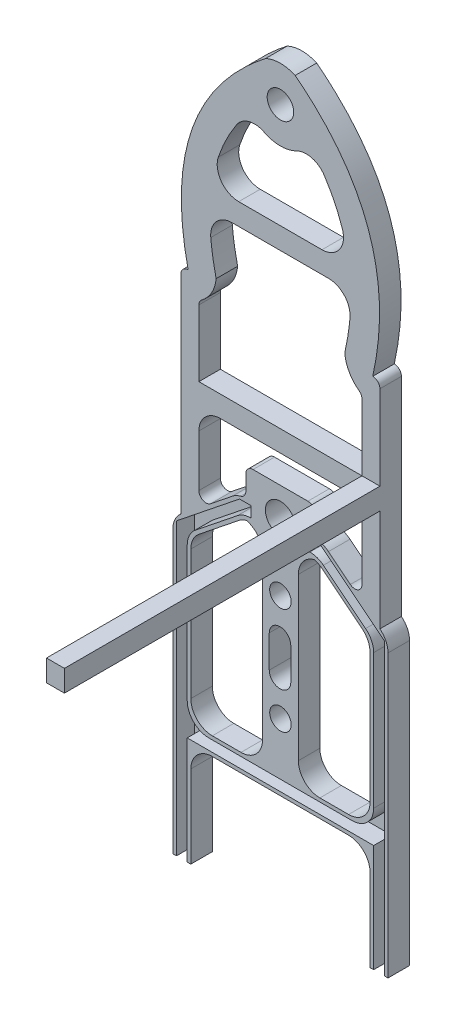
from build123d import *

# Parameters (mm, degrees)
SKETCH1_R            = 15
BOSS_EXTRUDE2_DEPTH  = 30
CUT_EXTRUDE1_DEPTH   = 25
SKETCH5_W            = 50
SKETCH5_H            = 200
SKETCH5_H_2          = 175
CUT_EXTRUDE2_DEPTH   = 30
FILLET12_R           = 30
SKETCH6_W            = 25
SKETCH6_H            = 285
BOSS_EXTRUDE3_DEPTH  = 30
SKETCH7_R            = 15
CUT_EXTRUDE3_DEPTH   = 30
FILLET13_R           = 30
FILLET14_R           = 30
SKETCH8_W            = 30
SKETCH8_H            = 75
CUT_EXTRUDE4_DEPTH   = 30
FILLET15_R           = 15
FILLET16_R           = 15
SKETCH9_W            = 338.809244033
SKETCH9_H            = 97.141111926
CUT_EXTRUDE5_DEPTH   = 180
FILLET17_R           = 30
SKETCH10_W           = 327.747288066
SKETCH10_H           = 89.1185355
CUT_EXTRUDE6_DEPTH   = 50
SKETCH11_W           = 96.492189406
SKETCH11_H           = 40
BOSS_EXTRUDE5_DEPTH  = 30
SKETCH12_R           = 15
CUT_EXTRUDE7_DEPTH   = 30
FILLET18_R           = 10
BOSS_EXTRUDE6_DEPTH  = 30
FILLET19_R           = 10
SKETCH18_W           = 81.820550709
SKETCH18_H           = 15
BOSS_EXTRUDE11_DEPTH = 30
SKETCH19_R           = 21
CUT_EXTRUDE9_DEPTH   = 500
SKETCH20_R           = 18.5
BOSS_EXTRUDE12_DEPTH = 30
SKETCH21_W           = 25
SKETCH21_H           = 30
BOSS_EXTRUDE13_DEPTH = 440
SKETCH22_W           = 179.403270764
SKETCH22_H           = 25
CUT_EXTRUDE10_DEPTH  = 440
SKETCH23_W           = 219.281894342
SKETCH23_H           = 30
BOSS_EXTRUDE14_DEPTH = 30
FILLET25_R           = 50
BOSS_EXTRUDE16_REACH = 1016.707
SKETCH26_W           = 30
SKETCH26_H           = 29.541809427
FILLET26_R           = 30
FILLET28_R           = 30


# Some blends are built 0.0001 mm under size
with BuildPart() as part:
    # Sketch1 → Boss-Extrude2 (new body)
    with BuildSketch(Plane.XY):
        Polygon((25, -200), (-25, -200), (-25, -25), (-125, -25), (-125, -400), (-150, -400), (-150, 0), (-150, 237.015621187), (-58.769526484, 310), (58.769526484, 310), (150, 237.015621187), (150, 0), (150, -400), (125, -400), (125, -25), (25, -25), align=None)
        with Locations((0, 162.622371244)):
            Circle(SKETCH1_R, mode=Mode.SUBTRACT)
        with Locations((0, -162.622371244)):
            Circle(SKETCH1_R, mode=Mode.SUBTRACT)
        Polygon((25, 200), (-25, 200), (-25, 0), (-125, 0), (-125, 225), (-50, 285), (50, 285), (125, 225), (125, 0), (25, 0), align=None, mode=Mode.SUBTRACT)
    extrude(amount=BOSS_EXTRUDE2_DEPTH)

    # Sketch2 → Cut-Extrude1 (cut)
    with BuildSketch(Plane.XY.offset(30)):
        Polygon((145, -400), (145, 234.61249695), (57.015621187, 305), (-57.015621187, 305), (-145, 234.61249695), (-145, -400), (-130, -400), (-130, -25), (-130, -20), (-125, -20), (-25, -20), (25, -20), (125, -20), (130, -20), (130, -25), (130, -400), align=None)
        Polygon((130, 0), (130, 227.403124237), (51.753905297, 290), (-51.753905297, 290), (-130, 227.403124237), (-130, 0), (-130, -5), (-125, -5), (-25, -5), (25, -5), (125, -5), (130, -5), align=None, mode=Mode.SUBTRACT)
    extrude(amount=-CUT_EXTRUDE1_DEPTH, mode=Mode.SUBTRACT)

    # Sketch5 → Cut-Extrude2 (cut)
    with BuildSketch(Plane.XY.offset(30)):
        with Locations((0, 100)):
            Rectangle(SKETCH5_W, SKETCH5_H)
        with Locations((0, -112.5)):
            Rectangle(SKETCH5_W, SKETCH5_H_2)
    extrude(amount=-CUT_EXTRUDE2_DEPTH, mode=Mode.SUBTRACT)

    # Fillet12
    fillet12_edges = [part.edges().sort_by_distance(p)[0] for p in [
        (-51.753905297, 290, 17.5),
        (51.753905297, 290, 17.5),
    ]]
    fillet(fillet12_edges, radius=FILLET12_R)

    # Sketch6 → Boss-Extrude3 (add)
    with BuildSketch(Plane(origin=(0, 0, 0), x_dir=(-1, 0, 0), z_dir=(0, 0, -1))):
        with Locations((-12.5, 142.5)):
            Rectangle(SKETCH6_W, SKETCH6_H)
        with Locations((12.5, 142.5)):
            Rectangle(SKETCH6_W, SKETCH6_H)
    extrude(amount=-BOSS_EXTRUDE3_DEPTH)

    # Sketch7 → Cut-Extrude3 (cut)
    with BuildSketch(Plane(origin=(0, 0, 0), x_dir=(-1, 0, 0), z_dir=(0, 0, -1))):
        with Locations((0, 216.75)):
            Circle(SKETCH7_R)
        with Locations(Location((0, 68.25, 0), (0, 0, 180))):
            Circle(SKETCH7_R)
    extrude(amount=-CUT_EXTRUDE3_DEPTH, mode=Mode.SUBTRACT)

    # Fillet13
    # the kernel refuses this fillet: 30 mm, written as the material it adds along each edge
    with BuildSketch(Plane(origin=(-25, 0, 0), x_dir=(-1, 0, 0), z_dir=(0, 0, 1)), Plane(origin=(-25, 285, 0), x_dir=(0, -1, 0), z_dir=(0, 0, 1)), Plane(origin=(125, 0, 0), x_dir=(-1, 0, 0), z_dir=(0, 0, 1))) as fillet13_piece_1:
        with BuildLine():
            CenterArc((FILLET13_R, -FILLET13_R), FILLET13_R, 90, 90)
            Line((0, -FILLET13_R), (0, 0))
            Line((0, 0), (FILLET13_R, 0))
        make_face()
    extrude(amount=30)
    with BuildSketch(Plane(origin=(25, 0, 0), x_dir=(1, 0, 0), z_dir=(0, 0, 1)), Plane(origin=(25, 285, 0), x_dir=(0, -1, 0), z_dir=(0, 0, 1)), Plane(origin=(-125, 0, 0), x_dir=(1, 0, 0), z_dir=(0, 0, 1))) as fillet13_piece_2:
        with BuildLine():
            CenterArc((FILLET13_R, FILLET13_R), FILLET13_R, 180, 90)
            Line((0, FILLET13_R), (0, 0))
            Line((0, 0), (FILLET13_R, 0))
        make_face()
    extrude(amount=30)
    with BuildSketch(Plane(origin=(125, 225, 0), x_dir=(0, -1, 0), z_dir=(0, 0, 1))) as fillet13_piece_3:
        with BuildLine():
            CenterArc((FILLET13_R * 0.480624847487, -FILLET13_R), FILLET13_R, 90, 51.340191746)
            Line((-FILLET13_R * 0.300243961956, -FILLET13_R * 0.375304952446), (0, 0))
            Line((0, 0), (FILLET13_R * 0.480624847487, 0))
        make_face()
    extrude(amount=30)
    with BuildSketch(Plane(origin=(50, 285, 0), x_dir=(-1, 0, 0), z_dir=(0, 0, 1)), Plane(origin=(-50, 285, 0), x_dir=(-0.7808688094430287, -0.6246950475544262, 0), z_dir=(0, 0, 1))) as fillet13_piece_4:
        with BuildLine():
            CenterArc((FILLET13_R * 0.350781059358, FILLET13_R), FILLET13_R, 231.340191746, 38.659808254)
            Line((-FILLET13_R * 0.273913988196, FILLET13_R * 0.219131190557), (0, 0))
            Line((0, 0), (FILLET13_R * 0.350781059358, 0))
        make_face()
    extrude(amount=30)
    with BuildSketch(Plane(origin=(-125, 225, 0), x_dir=(0, -1, 0), z_dir=(0, 0, 1))) as fillet13_piece_5:
        with BuildLine():
            CenterArc((FILLET13_R * 0.480624847487, FILLET13_R), FILLET13_R, 218.659808254, 51.340191746)
            Line((-FILLET13_R * 0.300243961956, FILLET13_R * 0.375304952446), (0, 0))
            Line((0, 0), (FILLET13_R * 0.480624847487, 0))
        make_face()
    extrude(amount=30)
    # the kernel refuses this fillet: 30 mm, written as the material it takes off along each edge
    with BuildSketch(Plane(origin=(-150, 237.015621187, -36.046863561), x_dir=(0, -1, 0), z_dir=(0, 0, 1))) as fillet13_2_piece_1:
        with BuildLine():
            CenterArc((FILLET13_R * 0.480624847487, FILLET13_R), FILLET13_R, 218.659808254, 51.340191746)
            Line((-FILLET13_R * 0.300243961956, FILLET13_R * 0.375304952446), (0, 0))
            Line((0, 0), (FILLET13_R * 0.480624847487, 0))
        make_face()
    extrude(amount=102.093727123, mode=Mode.SUBTRACT)
    with BuildSketch(Plane(origin=(-58.769526484, 310, -26.308579452), x_dir=(1, 0, 0), z_dir=(0, 0, 1)), Plane(origin=(58.769526484, 310, -26.308579452), x_dir=(0.7808688094430305, -0.6246950475544238, 0), z_dir=(0, 0, 1))) as fillet13_2_piece_2:
        with BuildLine():
            CenterArc((FILLET13_R * 0.350781059358, -FILLET13_R), FILLET13_R, 90, 38.659808254)
            Line((-FILLET13_R * 0.273913988196, -FILLET13_R * 0.219131190557), (0, 0))
            Line((0, 0), (FILLET13_R * 0.350781059358, 0))
        make_face()
    extrude(amount=82.617158904, mode=Mode.SUBTRACT)
    with BuildSketch(Plane(origin=(150, 237.015621187, -36.046863561), x_dir=(0, -1, 0), z_dir=(0, 0, 1))) as fillet13_2_piece_3:
        with BuildLine():
            CenterArc((FILLET13_R * 0.480624847487, -FILLET13_R), FILLET13_R, 90, 51.340191746)
            Line((-FILLET13_R * 0.300243961956, -FILLET13_R * 0.375304952446), (0, 0))
            Line((0, 0), (FILLET13_R * 0.480624847487, 0))
        make_face()
    extrude(amount=102.093727123, mode=Mode.SUBTRACT)

    # Fillet14
    fillet14_edges = [part.edges().sort_by_distance(p)[0] for p in [
        (-130, 227.403124237, 17.5),
        (130, 227.403124237, 17.5),
        (130, -5, 17.5),
        (-130, -5, 17.5),
    ]]
    fillet(fillet14_edges, radius=FILLET14_R)

    # Sketch8 → Cut-Extrude4 (cut)
    with BuildSketch(Plane.XY.offset(30)):
        with Locations((-0.603833869, 141.522485527)):
            Rectangle(SKETCH8_W, SKETCH8_H)
    extrude(amount=-CUT_EXTRUDE4_DEPTH, mode=Mode.SUBTRACT)

    # Fillet15
    fillet15_edges = [part.edges().sort_by_distance(p)[0] for p in [
        (-15.603833869, 179.022485527, 15),
        (14.396166131, 179.022485527, 15),
    ]]
    fillet(fillet15_edges, radius=FILLET15_R - 0.0001)  # a hair under: the kernel refuses the full size

    # Fillet16
    fillet16_edges = [part.edges().sort_by_distance(p)[0] for p in [
        (-15.603833869, 104.022485527, 15),
        (14.396166131, 104.022485527, 15),
    ]]
    fillet(fillet16_edges, radius=FILLET16_R - 0.0001)  # a hair under: the kernel refuses the full size

    # Sketch9 → Cut-Extrude5 (cut)
    with BuildSketch(Plane.XZ.offset(400)):
        with Locations((2.764177981, 12.038380734)):
            Rectangle(SKETCH9_W, SKETCH9_H)
    extrude(amount=-CUT_EXTRUDE5_DEPTH, mode=Mode.SUBTRACT)

    # Fillet17
    fillet17_edges = [part.edges().sort_by_distance(p)[0] for p in [
        (-125, -25, 15),
        (125, -25, 15),
    ]]
    fillet(fillet17_edges, radius=FILLET17_R)

    # Sketch10 → Cut-Extrude6 (cut)
    with BuildSketch(Plane.XZ.offset(220)):
        with Locations((2.723742007, 14.352989255)):
            Rectangle(SKETCH10_W, SKETCH10_H)
    extrude(amount=-CUT_EXTRUDE6_DEPTH, mode=Mode.SUBTRACT)

    # Sketch11 → Boss-Extrude5 (add)
    with BuildSketch(Plane(origin=(0, 0, 0), x_dir=(-1, 0, 0), z_dir=(0, 0, -1))):
        with Locations((0, 330)):
            Rectangle(SKETCH11_W, SKETCH11_H)
    extrude(amount=-BOSS_EXTRUDE5_DEPTH)

    # Sketch12 → Cut-Extrude7 (cut)
    with BuildSketch(Plane(origin=(0, 0, 0), x_dir=(-1, 0, 0), z_dir=(0, 0, -1))):
        with Locations((0, 309.75)):
            Circle(SKETCH12_R)
    extrude(amount=-CUT_EXTRUDE7_DEPTH, mode=Mode.SUBTRACT)

    # Fillet18
    fillet18_edges = [part.edges().sort_by_distance(p)[0] for p in [
        (-48.246094703, 310, 15),
        (48.246094703, 310, 15),
        (48.246094703, 350, 15),
        (-48.246094703, 350, 15),
    ]]
    fillet(fillet18_edges, radius=FILLET18_R)

    # Sketch13 → Boss-Extrude6 (add)
    with BuildSketch(Plane(origin=(0, 0, 0), x_dir=(-1, 0, 0), z_dir=(0, 0, -1))):
        Polygon((138.740851427, 246.022940046), (138.740851427, 546.022940046), (-138.740851427, 546.022940046), (-138.740851427, 246.022940046), (-113.740851427, 266.022940046), (-113.740851427, 521.022940046), (113.740851427, 521.022940046), (113.740851427, 266.022940046), align=None)
    extrude(amount=-BOSS_EXTRUDE6_DEPTH)

    # Fillet19
    fillet19_edges = [part.edges().sort_by_distance(p)[0] for p in [
        (-113.740851427, 266.022940046, 15),
        (-113.740851427, 521.022940046, 15),
        (113.740851427, 521.022940046, 15),
        (113.740851427, 266.022940046, 15),
        (138.740851427, 546.022940046, 15),
        (-138.740851427, 546.022940046, 15),
    ]]
    fillet(fillet19_edges, radius=FILLET19_R)

    # Sketch18 → Boss-Extrude11 (add, through all)
    with BuildSketch(Plane.XY.offset(30)):
        with Locations((-0.320198162, 297.5)):
            Rectangle(SKETCH18_W, SKETCH18_H)
    extrude(amount=-BOSS_EXTRUDE11_DEPTH)

    # Sketch19 → Cut-Extrude9 (cut)
    with BuildSketch(Plane.XY.offset(30)):
        with Locations((0, 309.75)):
            Circle(SKETCH19_R)
    extrude(amount=-CUT_EXTRUDE9_DEPTH, mode=Mode.SUBTRACT)

    # Sketch20 → Boss-Extrude12 (add)
    with BuildSketch(Plane(origin=(0, 0, 0), x_dir=(-1, 0, 0), z_dir=(0, 0, -1))):
        with BuildLine():
            add(Edge.make_bspline(
                [(89.701635382, 554.737273676), (90.94148044, 560.181929688), (94.121591054, 576.229523324), (97.653790592, 602.020813506), (98.983134054, 636.143564767), (95.23140752, 672.288382312), (86.385439091, 705.942796648), (72.424108525, 737.575728698), (55.122350666, 764.46748221), (43.463482556, 778.623614239), (41.125546485, 781.312534813)],
                knots=[0, 0, 0, 0.03125, 0.09375, 0.1875, 0.3125, 0.4375, 0.5625, 0.6875, 0.786375361, 0.809812861, 0.809812861, 0.809812861], degree=2))
            ThreePointArc((41.125546485, 781.312534813), (0, 759.75), (-41.125546485, 781.312534813))
            add(Edge.make_bspline(
                [(-89.701635382, 554.737273676), (-90.919571876, 560.193489601), (-94.037995416, 576.275690508), (-97.480279525, 602.124540989), (-98.708860728, 636.327505878), (-94.875288423, 672.559825136), (-85.977994342, 706.289179821), (-71.998993475, 737.974820859), (-54.860852965, 764.66720221), (-43.448673053, 778.621697875), (-41.125546485, 781.312534813)],
                knots=[0, 0, 0, 0.03125, 0.09375, 0.1875, 0.3125, 0.4375, 0.5625, 0.6875, 0.784528557, 0.807966057, 0.807966057, 0.807966057], degree=2))
            Line((-89.701635382, 554.737273676), (-89.701635382, 546.022940046))
            Line((-89.701635382, 546.022940046), (-128.740851427, 546.022940046))
            add(Edge.make_bspline(
                [(-128.740851427, 546.022940046), (-171.550185162, 737.803849441), (-20.558571754, 855.327901745)],
                knots=[0, 0, 0, 1, 1, 1], degree=2))
            ThreePointArc((-20.558571754, 855.327901745), (0, 859.75), (20.558571754, 855.327901745))
            add(Edge.make_bspline(
                [(128.740851427, 546.022940046), (171.550185162, 737.803849441), (20.558571754, 855.327901745)],
                knots=[0, 0, 0, 1, 1, 1], degree=2))
            Line((128.740851427, 546.022940046), (89.701635382, 546.022940046))
            Line((89.701635382, 546.022940046), (89.701635382, 554.737273676))
        make_face()
        with Locations((0, 809.75)):
            Circle(SKETCH20_R, mode=Mode.SUBTRACT)
    extrude(amount=-BOSS_EXTRUDE12_DEPTH)

    # Sketch21 → Boss-Extrude13 (add)
    with BuildSketch(Plane.XY.offset(30)):
        with Locations((126.240851427, 403.356454138)):
            Rectangle(SKETCH21_W, SKETCH21_H)
    extrude(amount=BOSS_EXTRUDE13_DEPTH)

    # Sketch22 → Cut-Extrude10 (cut)
    with BuildSketch(Plane.XY.offset(30)):
        with Locations((0, 533.522940046)):
            Rectangle(SKETCH22_W, SKETCH22_H)
    extrude(amount=-CUT_EXTRUDE10_DEPTH, mode=Mode.SUBTRACT)

    # Sketch23 → Boss-Extrude14 (add)
    with BuildSketch(Plane.XY.offset(30)):
        with Locations((-0.142235085, 648.507085918)):
            Rectangle(SKETCH23_W, SKETCH23_H)
    extrude(amount=-BOSS_EXTRUDE14_DEPTH)

    # Fillet25
    # the kernel refuses this fillet: 50 mm, written as the material it takes off along each edge
    with BuildSketch(Plane(origin=(89.701635382, 521.022940046, 114.285834076), x_dir=(0, 1, 0), z_dir=(0, 0, -1))) as fillet25_piece_1:
        with BuildLine():
            CenterArc((38.178233738, 49.800337306), FILLET25_R, 216.585286152, 48.292641393)
            Line((-1.970294377, 19.999402922), (-5.985147189, 17.019309483))
            ThreePointArc((-5.985147189, 17.019309483), (-5, 14.039216045), (-5, 0))
            Line((-5, 0), (0, -5))
            ThreePointArc((0, -5), (16.857166815, -5), (33.26794362, -4.980033731))
            Line((33.26794362, -4.980033731), (33.714333631, 0))
        make_face()
    extrude(amount=198.571668153, mode=Mode.SUBTRACT)
    with BuildSketch(Plane(origin=(-89.701635382, 521.022940046, 114.285834076), x_dir=(-0.9951821774676909, -0.09804301938774279, 0), z_dir=(0, 0, -1))) as fillet25_piece_2:
        with BuildLine():
            CenterArc((45.817298809, 42.876873219), FILLET25_R, 190.748562392, 48.292641393)
            Line((-3.305455066, 33.551903954), (-8.217730453, 32.619407028))
            ThreePointArc((-8.217730453, 32.619407028), (-6.62863842, 16.28573688), (-4.975910887, -0.490215097))
            Line((-4.975910887, -0.490215097), (0.490215097, -4.975910887))
            ThreePointArc((0.490215097, -4.975910887), (14.46179269, -3.599463756), (17.524115372, -4.287687322))
            Line((17.524115372, -4.287687322), (20.096222957, 0))
        make_face()
    extrude(amount=198.571668153, mode=Mode.SUBTRACT)

    # Sketch26 → Boss-Extrude16 (add, up to next)
    with BuildSketch(Plane.ZY.offset(-113.740851427), mode=Mode.PRIVATE) as boss_extrude16_sk1:
        with Locations((15, 403.585549425)):
            Rectangle(SKETCH26_W, SKETCH26_H)
    boss_extrude16_tool1 = extrude(boss_extrude16_sk1.sketch, amount=BOSS_EXTRUDE16_REACH, mode=Mode.PRIVATE) - part.part
    add(boss_extrude16_tool1.solids().sort_by_distance((113.740851, 403.585549, 15))[0])

    # Fillet26
    fillet26_edges = [part.edges().sort_by_distance(p)[0] for p in [
        (41.125546485, 781.312534813, 15),
        (-41.125546485, 781.312534813, 15),
        (-98.382182309, 633.507085918, 15),
        (98.122261728, 633.507085918, 15),
        (-95.962833633, 663.507085918, 15),
        (95.663458218, 663.507085918, 15),
    ]]
    fillet(fillet26_edges, radius=FILLET26_R)

    # Fillet28
    # the kernel refuses this fillet: 30 mm, written as the material it adds along each edge
    with BuildSketch(Plane(origin=(-113.740851427, 388.814644711, 30), x_dir=(1, 0, 0), z_dir=(0, 0, -1))) as fillet28_piece_1:
        with BuildLine():
            CenterArc((FILLET28_R, FILLET28_R), FILLET28_R, 180, 90)
            Line((0, FILLET28_R), (0, 0))
            Line((0, 0), (FILLET28_R, 0))
        make_face()
    extrude(amount=30)
    with BuildSketch(Plane(origin=(113.740851427, 388.814644711, 0), x_dir=(0, -1, 0), z_dir=(0, 0, 1))) as fillet28_piece_2:
        with BuildLine():
            CenterArc((FILLET28_R, -FILLET28_R), FILLET28_R, 90, 90)
            Line((0, -FILLET28_R), (0, 0))
            Line((0, 0), (FILLET28_R, 0))
        make_face()
    extrude(amount=30)


solid = part.part
